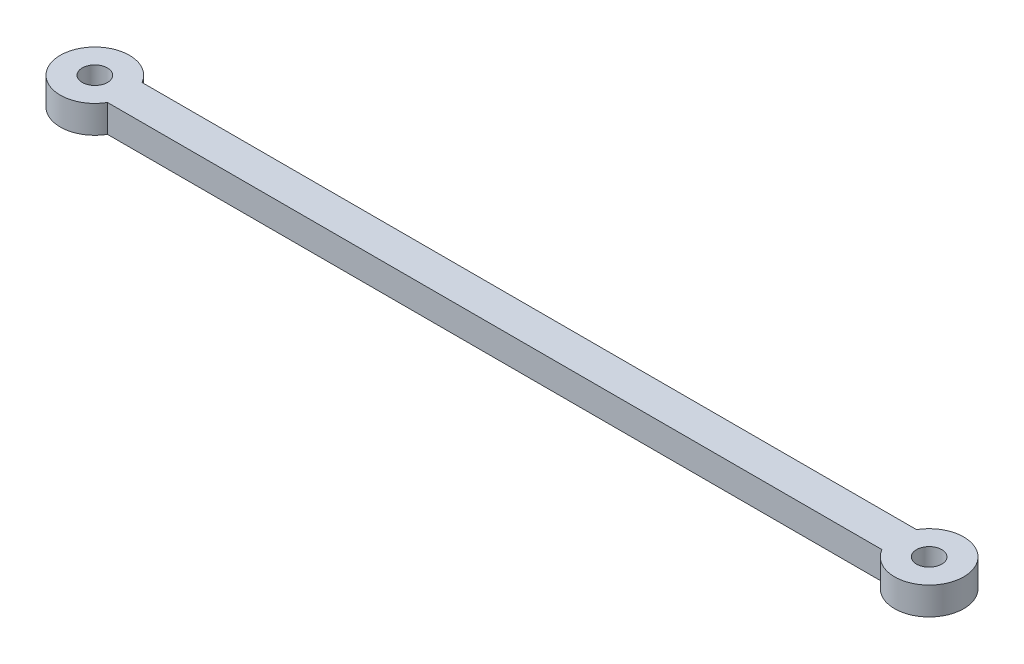
from build123d import *

# Parameters (mm, degrees)
BOSS_EXTRUDE1_DEPTH = 4
SKETCH2_R           = 1.825
CUT_EXTRUDE1_DEPTH  = 66.643167933


with BuildPart() as part:
    # Sketch1 → Boss-Extrude1 (new body)
    with BuildSketch(Plane(origin=(0, 0, 0), x_dir=(1, 0, 0), z_dir=(0, 1, 0))):
        with BuildLine():
            Line((-56, 2.5), (56, 2.5))
            ThreePointArc((56, 2.5), (65.330127019, 0), (56, -2.5))
            Line((56, -2.5), (-56, -2.5))
            ThreePointArc((-56, -2.5), (-65.330127019, 0), (-56, 2.5))
        make_face()
    extrude(amount=BOSS_EXTRUDE1_DEPTH)

    # Sketch2 → Cut-Extrude1 (cut, through all)
    with BuildSketch(Plane(origin=(0, 4, 0), x_dir=(1, 0, 0), z_dir=(0, 1, 0))):
        with Locations((-60.330127019, 0)):
            Circle(SKETCH2_R)
        with Locations((60.330127019, 0)):
            Circle(SKETCH2_R)
    extrude(amount=-CUT_EXTRUDE1_DEPTH, mode=Mode.SUBTRACT)


solid = part.part
